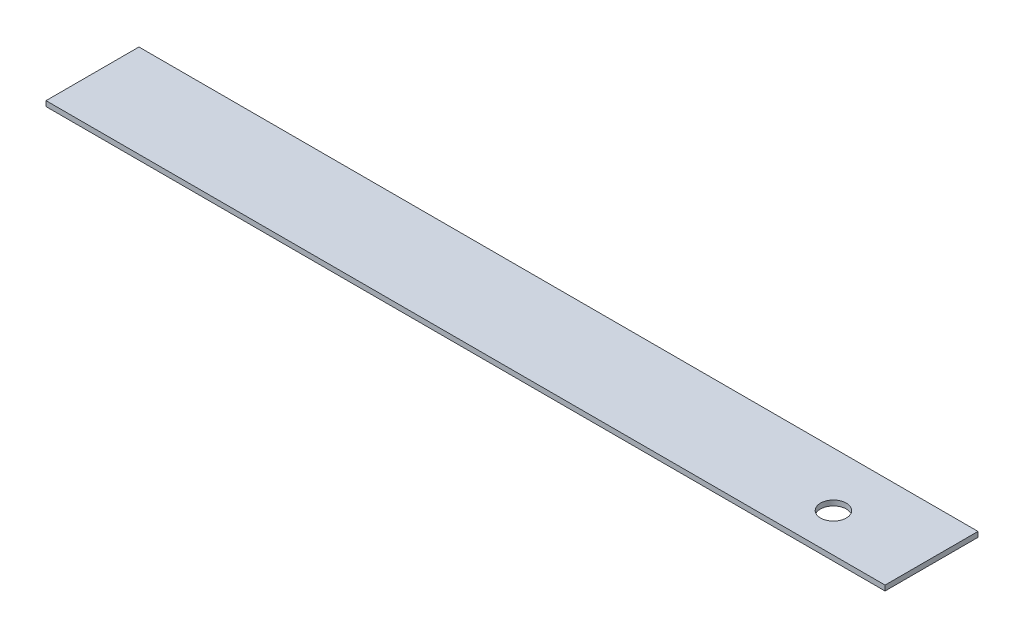
from build123d import *

# Parameters (mm, degrees)
ESBO_O1_W             = 36
ESBO_O1_H             = 2
FLANGE_BASE2_DEPTH    = 162.5
ESBO_O13_R            = 5
CORTE_EXTRUS_O4_DEPTH = 164.506116094


# Sheet-metal steps are written as plain solids
with BuildPart() as part:
    # Esboço1 → Flange-base2 (new, symmetric)
    with BuildSketch(Plane(origin=(0, 0, 0), x_dir=(0, 0, -1), z_dir=(1, 0, 0))):
        with Locations((0, -1)):
            Rectangle(ESBO_O1_W, ESBO_O1_H)
    extrude(amount=FLANGE_BASE2_DEPTH, both=True)

    # Esboço13 → Corte-extrusão4 (cut, through all)
    with BuildSketch(Plane.XZ.offset(2)):
        with Locations(Location((127.5, 3, 0), (0, 0, 270))):
            Circle(ESBO_O13_R)
    extrude(amount=-CORTE_EXTRUS_O4_DEPTH, mode=Mode.SUBTRACT)


solid = part.part
